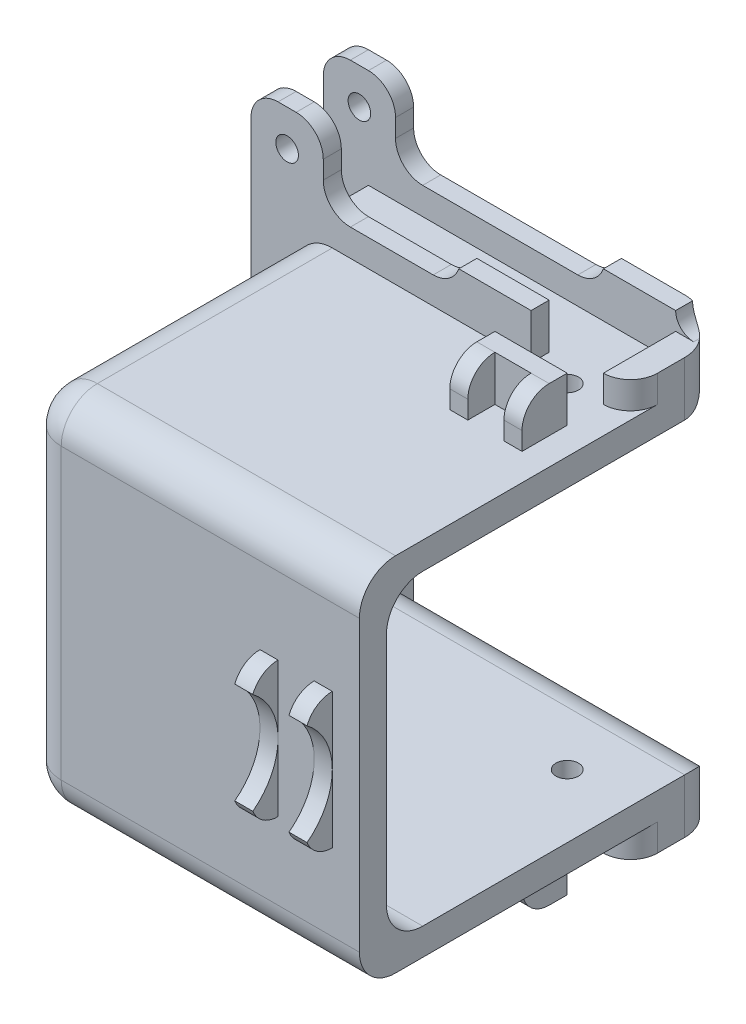
from build123d import *

# Parameters (mm, degrees)
ESTRUSIONE_ESTRUSIONE1_DEPTH  = 10
SCHIZZO6_W                    = 8
SCHIZZO6_H                    = 8
SCHIZZO6_H_2                  = 2
ESTRUSIONE_ESTRUSIONE4_DEPTH  = 10
TAGLIO_ESTRUSIONE1_DEPTH      = 54.150729064
SCHIZZO4_W                    = 3
SCHIZZO4_H                    = 6
ESTRUSIONE_ESTRUSIONE2_DEPTH  = 3
SCHIZZO5_W                    = 3
SCHIZZO5_H                    = 6
ESTRUSIONE_ESTRUSIONE3_DEPTH  = 3
SCHIZZO3_W                    = 5
SCHIZZO3_H                    = 6
TAGLIO_ESTRUSIONE2_DEPTH      = 67.820655489
FORO_FILETTATO_M3X0_5_1_D     = 2.5
ESTRUSIONE_ESTRUSIONE5_DEPTH  = 30
SCHIZZO10_W                   = 3
SCHIZZO10_H                   = 34
ESTRUSIONE_ESTRUSIONE6_DEPTH  = 34
SCHIZZO18_W                   = 8
SCHIZZO18_H                   = 8
TAGLIO_ESTRUSIONE3_DEPTH      = 5
SCHIZZO24_W                   = 8
SCHIZZO24_H                   = 2
ESTRUSIONE_ESTRUSIONE9_DEPTH  = 5
SCHIZZO23_W                   = 8
SCHIZZO23_H                   = 8
TAGLIO_ESTRUSIONE4_DEPTH      = 5
SCHIZZO25_W                   = 8
SCHIZZO25_H                   = 2
ESTRUSIONE_ESTRUSIONE10_DEPTH = 5
FORO_FILETTATO_M3X0_5_4_D     = 2.5
FORO_FILETTATO_M3X0_5_4_DEPTH = 7.5
FORO_FILETTATO_M3X0_5_4_TIP   = 0.751075774
FORO_FILETTATO_M3X0_5_5_D     = 2.5
FORO_FILETTATO_M3X0_5_5_DEPTH = 7.5
FORO_FILETTATO_M3X0_5_5_TIP   = 0.751075774
SCHIZZO11_W                   = 2
SCHIZZO11_H                   = 15
ESTRUSIONE_ESTRUSIONE7_DEPTH  = 3
SCHIZZO12_W                   = 2
SCHIZZO12_H                   = 5
ESTRUSIONE_ESTRUSIONE8_DEPTH  = 3
SCHIZZO28_W                   = 8
SCHIZZO28_H                   = 2
ESTRUSIONE_ESTRUSIONE11_DEPTH = 2
SCHIZZO29_W                   = 8
SCHIZZO29_H                   = 2
ESTRUSIONE_ESTRUSIONE12_DEPTH = 2
RACCORDO1_R                   = 4
RACCORDO2_DEPTH               = 2
RACCORDO2_START               = 8
RACCORDO2_2_DEPTH             = 2
RACCORDO2_START_2             = -1
RACCORDO2_3_DEPTH             = 12
RACCORDO2_START_3             = -23
RACCORDO2_4_DEPTH             = 3
RACCORDO2_START_4             = 20
RACCORDO2_5_DEPTH             = 3
RACCORDO2_START_5             = 31
RACCORDO2_6_DEPTH             = 8
RACCORDO30_R                  = 2
SCHIZZO30_R                   = 7
TAGLIO_ESTRUSIONE5_DEPTH      = 17


with BuildPart() as part:
    # Schizzo1 → Estrusione-Estrusione1 (new body)
    with BuildSketch(Plane.XY):
        Polygon((0, -23), (42, -23), (42, -17), (8, -17), (8, 17), (42, 17), (42, 23), (0, 23), align=None)
    extrude(amount=ESTRUSIONE_ESTRUSIONE1_DEPTH)

    # Schizzo6 → Estrusione-Estrusione4 (add)
    with BuildSketch(Plane.XY.offset(10)):
        with Locations((4, -27)):
            Rectangle(SCHIZZO6_W, SCHIZZO6_H)
        with Locations((4, 27)):
            Rectangle(SCHIZZO6_W, SCHIZZO6_H)
        with Locations((35, -24)):
            Rectangle(SCHIZZO6_W, SCHIZZO6_H_2)
        with Locations((35, 24)):
            Rectangle(SCHIZZO6_W, SCHIZZO6_H_2)
    extrude(amount=-ESTRUSIONE_ESTRUSIONE4_DEPTH)

    # Schizzo2 → Taglio-Estrusione1 (cut, through all)
    with BuildSketch(Plane(origin=(42, 0, 0), x_dir=(0, 0, -1), z_dir=(1, 0, 0))):
        Polygon((-8, -23), (-8, -41.817102562), (-2, -41.817102562), (-2, -22.5), (-2, -20), (-8, -20), align=None)
    taglio_estrusione1 = extrude(amount=-TAGLIO_ESTRUSIONE1_DEPTH, mode=Mode.SUBTRACT)

    # Schizzo4 → Estrusione-Estrusione2 (add)
    with BuildSketch(Plane(origin=(0, -20, 0), x_dir=(-1, 0, 0), z_dir=(0, -1, 0))):
        with Locations((-40.5, -5)):
            Rectangle(SCHIZZO4_W, SCHIZZO4_H)
    extrude(amount=ESTRUSIONE_ESTRUSIONE2_DEPTH)

    # Specchia1: Taglio-Estrusione1 across plane
    add(taglio_estrusione1.mirror(Plane.ZX), mode=Mode.SUBTRACT)

    # Schizzo5 → Estrusione-Estrusione3 (add)
    with BuildSketch(Plane(origin=(0, 20, 0), x_dir=(1, 0, 0), z_dir=(0, 1, 0))):
        with Locations((40.5, -5)):
            Rectangle(SCHIZZO5_W, SCHIZZO5_H)
    extrude(amount=ESTRUSIONE_ESTRUSIONE3_DEPTH)

    # Schizzo3 → Taglio-Estrusione2 (cut, through all)
    with BuildSketch(Plane.XZ.offset(20)):
        with Locations((2.5, 5)):
            Rectangle(SCHIZZO3_W, SCHIZZO3_H)
    extrude(amount=-TAGLIO_ESTRUSIONE2_DEPTH, mode=Mode.SUBTRACT)

    # Foro filettato M3x0.5-1 (through all)
    with Locations(Plane.XY.offset(10)):
        with Locations((4, -27), (4, 27)):
            Hole(FORO_FILETTATO_M3X0_5_1_D / 2)

    # Schizzo9 → Estrusione-Estrusione5 (add)
    with BuildSketch(Plane.XY.offset(10)):
        Polygon((5, -20), (42, -20), (42, -17), (8, -17), (8, 17), (42, 17), (42, 20), (5, 20), align=None)
    extrude(amount=ESTRUSIONE_ESTRUSIONE5_DEPTH)

    # Schizzo10 → Estrusione-Estrusione6 (add)
    with BuildSketch(Plane(origin=(8, 0, 0), x_dir=(0, 0, -1), z_dir=(1, 0, 0))):
        with Locations((-38.5, 0)):
            Rectangle(SCHIZZO10_W, SCHIZZO10_H)
    extrude(amount=ESTRUSIONE_ESTRUSIONE6_DEPTH)

    # Schizzo18 → Taglio-Estrusione3 (cut)
    with BuildSketch(Plane.XZ.offset(25)):
        with Locations((35, 12)):
            Rectangle(SCHIZZO18_W, SCHIZZO18_H)
    extrude(amount=-TAGLIO_ESTRUSIONE3_DEPTH, mode=Mode.SUBTRACT)

    # Schizzo24 → Estrusione-Estrusione9 (add)
    with BuildSketch(Plane.XZ.offset(20)):
        with Locations((35, 15)):
            Rectangle(SCHIZZO24_W, SCHIZZO24_H)
    extrude(amount=ESTRUSIONE_ESTRUSIONE9_DEPTH)

    # Schizzo23 → Taglio-Estrusione4 (cut)
    with BuildSketch(Plane(origin=(0, 25, 0), x_dir=(1, 0, 0), z_dir=(0, 1, 0))):
        with Locations((35, -12)):
            Rectangle(SCHIZZO23_W, SCHIZZO23_H)
    extrude(amount=-TAGLIO_ESTRUSIONE4_DEPTH, mode=Mode.SUBTRACT)

    # Schizzo25 → Estrusione-Estrusione10 (add)
    with BuildSketch(Plane(origin=(0, 20, 0), x_dir=(1, 0, 0), z_dir=(0, 1, 0))):
        with Locations((35, -15)):
            Rectangle(SCHIZZO25_W, SCHIZZO25_H)
    extrude(amount=ESTRUSIONE_ESTRUSIONE10_DEPTH)

    # Foro filettato M3x0.5-4
    with Locations(Plane(origin=(0, -20, 0), x_dir=(-1, 0, 0), z_dir=(0, -1, 0))):
        with Locations((-35, -10)):
            Hole(FORO_FILETTATO_M3X0_5_4_D / 2, depth=FORO_FILETTATO_M3X0_5_4_DEPTH)
            with Locations((0, 0, -(FORO_FILETTATO_M3X0_5_4_DEPTH + FORO_FILETTATO_M3X0_5_4_TIP / 2))):  # 118° drill point
                Cone(0, FORO_FILETTATO_M3X0_5_4_D / 2, FORO_FILETTATO_M3X0_5_4_TIP, mode=Mode.SUBTRACT)

    # Foro filettato M3x0.5-5
    with Locations(Plane(origin=(0, 20, 0), x_dir=(1, 0, 0), z_dir=(0, 1, 0))):
        with Locations((35, -10)):
            Hole(FORO_FILETTATO_M3X0_5_5_D / 2, depth=FORO_FILETTATO_M3X0_5_5_DEPTH)
            with Locations((0, 0, -(FORO_FILETTATO_M3X0_5_5_DEPTH + FORO_FILETTATO_M3X0_5_5_TIP / 2))):  # 118° drill point
                Cone(0, FORO_FILETTATO_M3X0_5_5_D / 2, FORO_FILETTATO_M3X0_5_5_TIP, mode=Mode.SUBTRACT)

    # Schizzo11 → Estrusione-Estrusione7 (add)
    with BuildSketch(Plane.XY.offset(40)):
        with Locations((38, 0)):
            Rectangle(SCHIZZO11_W, SCHIZZO11_H)
        with Locations((32, 0)):
            Rectangle(SCHIZZO11_W, SCHIZZO11_H)
    extrude(amount=ESTRUSIONE_ESTRUSIONE7_DEPTH)

    # Schizzo12 → Estrusione-Estrusione8 (add)
    with BuildSketch(Plane.XY.offset(16)):
        with Locations((38, -22.5)):
            Rectangle(SCHIZZO12_W, SCHIZZO12_H)
        with Locations((32, -22.5)):
            Rectangle(SCHIZZO12_W, SCHIZZO12_H)
    estrusione_estrusione8 = extrude(amount=ESTRUSIONE_ESTRUSIONE8_DEPTH)

    # Schizzo28 → Estrusione-Estrusione11 (add)
    with BuildSketch(Plane.XZ.offset(23)):
        with Locations((27, 9)):
            Rectangle(SCHIZZO28_W, SCHIZZO28_H)
    extrude(amount=ESTRUSIONE_ESTRUSIONE11_DEPTH)

    # Schizzo29 → Estrusione-Estrusione12 (add)
    with BuildSketch(Plane(origin=(0, 23, 0), x_dir=(1, 0, 0), z_dir=(0, 1, 0))):
        with Locations((27, -9)):
            Rectangle(SCHIZZO29_W, SCHIZZO29_H)
    extrude(amount=ESTRUSIONE_ESTRUSIONE12_DEPTH)

    # Specchia2: Estrusione-Estrusione8 across plane
    add(estrusione_estrusione8.mirror(Plane.ZX))

    # Raccordo1
    raccordo1_edges = [part.edges().sort_by_distance(p)[0] for p in [
        (23.5, -20, 40),
        (23.5, 20, 40),
        (5, 0, 40),
        (5, 20, 25),
        (5, -20, 25),
        (42, 20, 0),
        (42, -20, 0),
        (25, -17, 37),
        (25, -17, 0),
        (25, 17, 37),
        (25, 17, 0),
    ]]
    fillet(raccordo1_edges, radius=RACCORDO1_R)

    # Raccordo2: read off the stored shape, not the designer's step
    # Raccordo2 outline → Raccordo2 (add)
    with BuildSketch(Plane.XY):
        with BuildLine():
            Line((8, -23), (8, -26))
            ThreePointArc((8, -26), (8.878679656, -23.878679656), (11, -23))
            Line((11, -23), (8, -23))
        make_face()
        with BuildLine():
            Line((8, 23), (11, 23))
            ThreePointArc((11, 23), (8.878679656, 23.878679656), (8, 26))
            Line((8, 26), (8, 23))
        make_face()
        with BuildLine():
            Line((31, 23), (31, 25))
            ThreePointArc((31, 25), (29.903623683, 23.550510257), (28.171572875, 23))
            Line((28.171572875, 23), (31, 23))
        make_face()
        with BuildLine():
            ThreePointArc((28.171572875, -23), (29.903623683, -23.550510257), (31, -25))
            Line((31, -25), (31, -23))
            Line((31, -23), (28.171572875, -23))
        make_face()
    extrude(amount=RACCORDO2_DEPTH)

    # Raccordo2 2 outline → Raccordo2 2 (add)
    with BuildSketch(Plane.XY.offset(RACCORDO2_START)):
        with BuildLine():
            ThreePointArc((23, 25), (21.903623683, 23.550510257), (20.171572875, 23))
            Line((20.171572875, 23), (23, 23))
            Line((23, 23), (23, 25))
        make_face()
        with BuildLine():
            Line((23, -23), (20.171572875, -23))
            ThreePointArc((20.171572875, -23), (21.903623683, -23.550510257), (23, -25))
            Line((23, -25), (23, -23))
        make_face()
        with BuildLine():
            Line((8, -23), (8, -26))
            ThreePointArc((8, -26), (8.878679656, -23.878679656), (11, -23))
            Line((11, -23), (8, -23))
        make_face()
        with BuildLine():
            Line((8, 23), (11, 23))
            ThreePointArc((11, 23), (8.878679656, 23.878679656), (8, 26))
            Line((8, 26), (8, 23))
        make_face()
    extrude(amount=RACCORDO2_2_DEPTH)

    # Raccordo2 3 outline → Raccordo2 3 (cut)
    with BuildSketch(Plane.XY.offset(RACCORDO2_START_2)):
        with BuildLine():
            ThreePointArc((8, -28), (7.121320344, -30.121320344), (5, -31))
            Line((5, -31), (8, -31))
            Line((8, -31), (8, -28))
        make_face()
        with BuildLine():
            ThreePointArc((3, -31), (0.878679656, -30.121320344), (0, -28))
            Line((0, -28), (0, -31))
            Line((0, -31), (3, -31))
        make_face()
        with BuildLine():
            ThreePointArc((0, 28), (0.878679656, 30.121320344), (3, 31))
            Line((3, 31), (0, 31))
            Line((0, 31), (0, 28))
        make_face()
        with BuildLine():
            ThreePointArc((5, 31), (7.121320344, 30.121320344), (8, 28))
            Line((8, 28), (8, 31))
            Line((8, 31), (5, 31))
        make_face()
    extrude(amount=RACCORDO2_3_DEPTH, mode=Mode.SUBTRACT)

    # Raccordo2 4 outline → Raccordo2 4 (cut)
    with BuildSketch(Plane(origin=(0, 0, 0), x_dir=(1, 0, 0), z_dir=(0, 1, 0)).offset(RACCORDO2_START_3)):
        with BuildLine():
            ThreePointArc((42, -7), (41.121320344, -9.121320344), (39, -10))
            Line((39, -10), (42, -10))
            Line((42, -10), (42, -7))
        make_face()
    extrude(amount=RACCORDO2_4_DEPTH, mode=Mode.SUBTRACT)

    # Raccordo2 5 outline → Raccordo2 5 (cut)
    with BuildSketch(Plane(origin=(0, 0, 0), x_dir=(1, 0, 0), z_dir=(0, 1, 0)).offset(RACCORDO2_START_4)):
        with BuildLine():
            ThreePointArc((42, -7), (41.121320344, -9.121320344), (39, -10))
            Line((39, -10), (42, -10))
            Line((42, -10), (42, -7))
        make_face()
    extrude(amount=RACCORDO2_5_DEPTH, mode=Mode.SUBTRACT)

    # Raccordo2 6 outline → Raccordo2 6 (cut)
    with BuildSketch(Plane.YZ.offset(RACCORDO2_START_5)):
        with BuildLine():
            ThreePointArc((22, 19), (24.121320344, 18.121320344), (25, 16))
            Line((25, 16), (25, 19))
            Line((25, 19), (22, 19))
        make_face()
        with BuildLine():
            ThreePointArc((-7.5, 40), (-6.621320344, 42.121320344), (-4.5, 43))
            Line((-4.5, 43), (-7.5, 43))
            Line((-7.5, 43), (-7.5, 40))
        make_face()
        with BuildLine():
            ThreePointArc((4.5, 43), (6.621320344, 42.121320344), (7.5, 40))
            Line((7.5, 40), (7.5, 43))
            Line((7.5, 43), (4.5, 43))
        make_face()
        with BuildLine():
            Line((-25, 19), (-25, 16))
            ThreePointArc((-25, 16), (-24.121320344, 18.121320344), (-22, 19))
            Line((-22, 19), (-25, 19))
        make_face()
    extrude(amount=RACCORDO2_6_DEPTH, mode=Mode.SUBTRACT)

    # Raccordo30
    raccordo30_edges = [part.edges().sort_by_distance(p)[0] for p in [
        (39, 23, 1.063508327),
        (39, -23, 1.063508327),
    ]]
    fillet(raccordo30_edges, radius=RACCORDO30_R - 0.0001)  # a hair under: the kernel refuses the full size

    # Schizzo30 → Taglio-Estrusione5 (cut)
    with BuildSketch(Plane(origin=(42, 0, 0), x_dir=(0, 0, -1), z_dir=(1, 0, 0))):
        with Locations((-47, 0)):
            Circle(SCHIZZO30_R)
    extrude(amount=-TAGLIO_ESTRUSIONE5_DEPTH, mode=Mode.SUBTRACT)


solid = part.part
